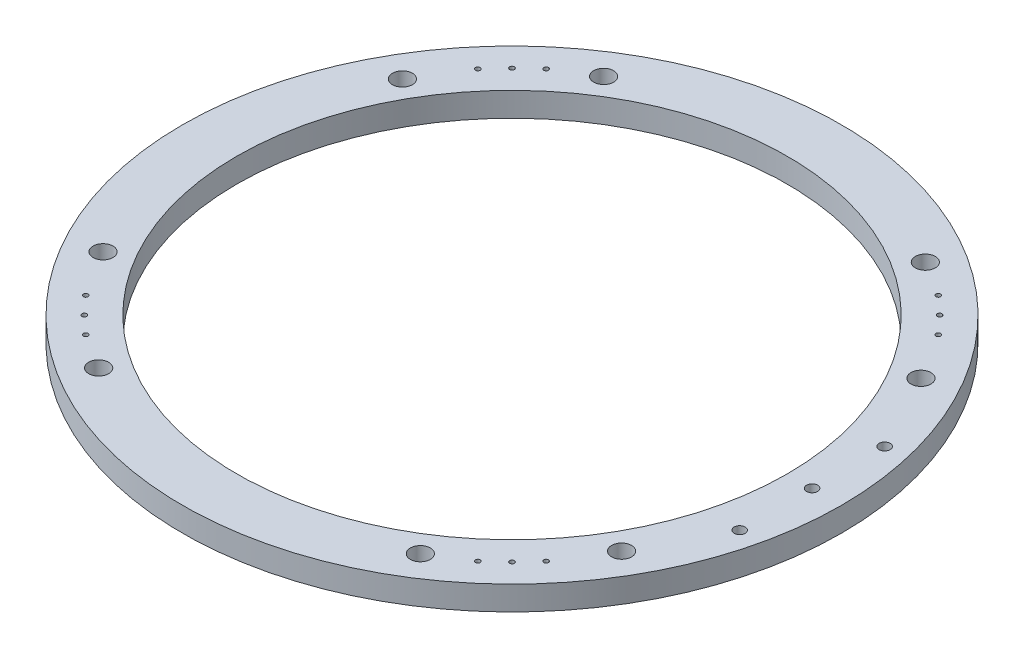
from build123d import *

# Parameters (mm, degrees)
TAP_DRILL_FOR_M3X0_5_TAP1_D = 2.5
CIRPATTERN1_COUNT           = 4
M5_CLEARANCE_HOLE1_D        = 5.8
Z_0_413_DIAMETER_HOLE1_D    = 10.4902


with BuildPart() as part:
    # Sketch1 → Revolve1 (revolve)
    with BuildSketch(Plane.XY):
        Polygon((144.698483179, 1017.4732), (144.698483179, 1004.7732), (152.4, 1004.7732), (173.273483179, 1004.7732), (173.273483179, 1017.4732), align=None)
    revolve(axis=Axis((0, 1125.81516809, 0), (0, -1, 0)))

    # Tap Drill for M3x0.5 Tap1 (through all)
    with Locations(Plane(origin=(0, 1004.7732, 0), x_dir=(-1, 0, 0), z_dir=(0, -1, 0))):
        with Locations((103.080559616, 121.041071858), (121.041071858, 103.080559616), (112.420066819, 112.420066819)):
            tap_drill_for_m3x0_5_tap1 = Hole(TAP_DRILL_FOR_M3X0_5_TAP1_D / 2)

    # CirPattern1: Tap Drill for M3x0.5 Tap1 ×4 about axis
    cirpattern1_axis = Axis((0, 1125.81516809, 0), (0, 1, 0))
    for i in range(1, CIRPATTERN1_COUNT):
        add(tap_drill_for_m3x0_5_tap1.rotate(cirpattern1_axis, i * 360 / CIRPATTERN1_COUNT), mode=Mode.SUBTRACT)

    # M5 Clearance Hole1 (through all)
    with Locations(Plane(origin=(0, 1017.4732, 0), x_dir=(1, 0, 0), z_dir=(0, 1, 0))):
        with Locations((157.7975, -38.1), (157.7975, 0), (157.7975, 38.1)):
            Hole(M5_CLEARANCE_HOLE1_D / 2)

    # Z (0.413) Diameter Hole1 (through all)
    with Locations(Plane(origin=(0, 1017.4732, 0), x_dir=(1, 0, 0), z_dir=(0, 1, 0))):
        with Locations((-136.31108495, -78.699241589), (136.31108495, -78.699241589), (136.31108495, 78.699241589), (-136.31108495, 78.699241589), (-84.570143366, 132.748534297), (84.570143366, 132.748534297), (84.570143366, -132.748534297), (-84.570143366, -132.748534297)):
            Hole(Z_0_413_DIAMETER_HOLE1_D / 2)


solid = part.part
